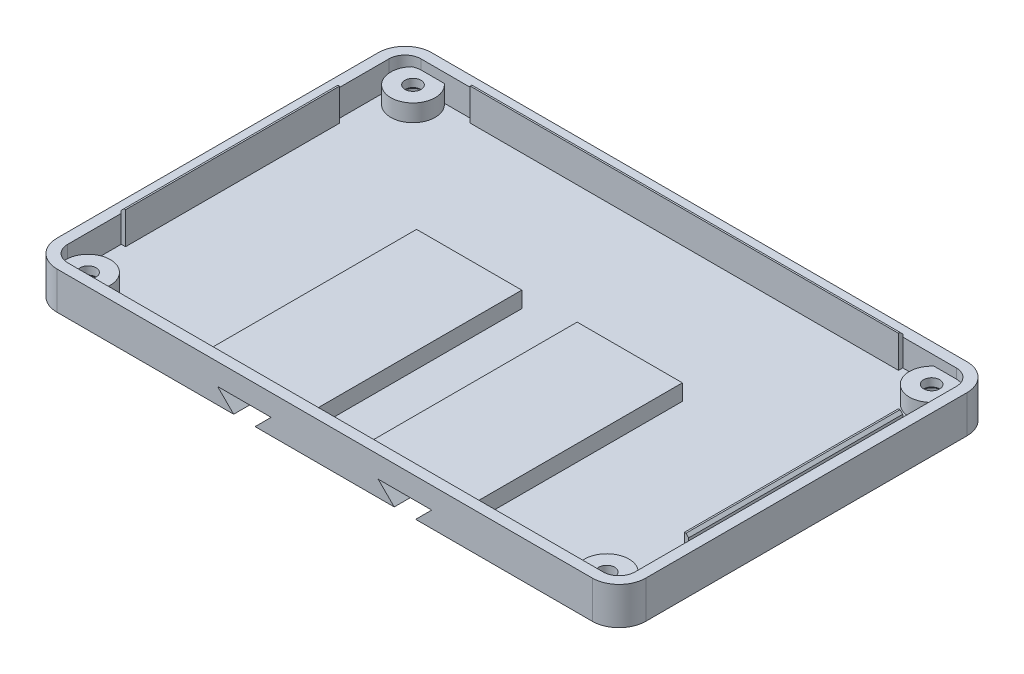
from build123d import *

# Parameters (mm, degrees)
SKETCH1_W               = 110
SKETCH1_H               = 70
BOSS_EXTRUDE1_DEPTH     = 7
FILLET1_R               = 5
CUT_EXTRUDE1_DEPTH      = 40
SHELL1_START            = 5
SHELL1_DEPTH            = 2
SHELL1_START_2          = 2
SHELL1_2_DEPTH          = 3
SHELL1_START_3          = -42
SHELL1_3_DEPTH          = 40
SHELL1_4_DEPTH          = 2
SKETCH2_W               = 80
SKETCH2_H               = 0.8
SKETCH2_W_2             = 0.8
SKETCH2_H_2             = 40
BOSS_EXTRUDE2_DEPTH     = 6
CHAMFER1_SIZE           = 0.5
SKETCH8_R               = 4.15
BOSS_EXTRUDE3_DEPTH     = 3.2
CUT_EXTRUDE5_DEPTH      = 131.48770057
CUT_EXTRUDE5_DEPTH_BACK = 131.48770057
SKETCH9_R               = 1.5
SKETCH10_R              = 3
CUT_EXTRUDE6_DEPTH      = 3.2
CHAMFER2_SIZE           = 0.5
BOSS_EXTRUDE4_REACH     = 120.017


with BuildPart() as part:
    # Sketch1 → Boss-Extrude1 (new body)
    with BuildSketch(Plane(origin=(0, 0, 0), x_dir=(1, 0, 0), z_dir=(0, 1, 0))):
        with Locations((55, 35)):
            Rectangle(SKETCH1_W, SKETCH1_H)
    extrude(amount=BOSS_EXTRUDE1_DEPTH)

    # Fillet1
    fillet1_edges = [part.edges().sort_by_distance(p)[0] for p in [
        (0, 3.5, -70),
        (110, 3.5, -70),
        (110, 3.5, 0),
        (0, 3.5, 0),
    ]]
    fillet(fillet1_edges, radius=FILLET1_R)

    # Sketch3 → Cut-Extrude1 (cut)
    with BuildSketch(Plane.XY):
        Polygon((38, 0), (35, 3), (45, 3), (42, 0), align=None)
        Polygon((68, 0), (65, 3), (75, 3), (72, 0), align=None)
    extrude(amount=-CUT_EXTRUDE1_DEPTH, mode=Mode.SUBTRACT)

    # Shell1: read off the stored shape, not the designer's step
    # Shell1 outline → Shell1 (cut)
    with BuildSketch(Plane(origin=(0, 0, 0), x_dir=(1, 0, 0), z_dir=(0, 1, 0)).offset(SHELL1_START)):
        with BuildLine():
            Line((2, 65), (2, 5))
            ThreePointArc((2, 5), (2.878679656, 2.878679656), (5, 2))
            Line((5, 2), (105, 2))
            ThreePointArc((105, 2), (107.121320344, 2.878679656), (108, 5))
            Line((108, 5), (108, 65))
            ThreePointArc((108, 65), (107.121320344, 67.121320344), (105, 68))
            Line((105, 68), (5, 68))
            ThreePointArc((5, 68), (2.878679656, 67.121320344), (2, 65))
        make_face()
    extrude(amount=SHELL1_DEPTH, mode=Mode.SUBTRACT)

    # Shell1 2 outline → Shell1 2 (cut)
    with BuildSketch(Plane(origin=(0, 0, 0), x_dir=(1, 0, 0), z_dir=(0, 1, 0)).offset(SHELL1_START_2)):
        with BuildLine():
            Line((2, 65), (2, 5))
            ThreePointArc((2, 5), (2.878679656, 2.878679656), (5, 2))
            Line((5, 2), (105, 2))
            ThreePointArc((105, 2), (107.121320344, 2.878679656), (108, 5))
            Line((108, 5), (108, 65))
            ThreePointArc((108, 65), (107.121320344, 67.121320344), (105, 68))
            Line((105, 68), (5, 68))
            ThreePointArc((5, 68), (2.878679656, 67.121320344), (2, 65))
        make_face()
    extrude(amount=SHELL1_2_DEPTH, mode=Mode.SUBTRACT)

    # Shell1 3 outline → Shell1 3 (add)
    with BuildSketch(Plane.XY.offset(SHELL1_START_3)):
        Polygon((36, 2), (35, 3), (45, 3), (44, 2), (46.828427125, 2), (49.828427125, 5), (30.171572875, 5), (33.171572875, 2), align=None)
        Polygon((60.171572875, 5), (63.171572875, 2), (66, 2), (65, 3), (75, 3), (74, 2), (76.828427125, 2), (79.828427125, 5), align=None)
    extrude(amount=SHELL1_3_DEPTH)

    # Shell1 4 outline → Shell1 4 (add)
    with BuildSketch(Plane.XY.offset(SHELL1_START_3)):
        Polygon((45, 3), (35, 3), (36, 2), (44, 2), align=None)
        Polygon((65, 3), (66, 2), (74, 2), (75, 3), align=None)
    extrude(amount=SHELL1_4_DEPTH)

    # Sketch2 → Boss-Extrude2 (add)
    with BuildSketch(Plane(origin=(0, 2, 0), x_dir=(1, 0, 0), z_dir=(0, 1, 0))):
        with Locations((55, 67.6)):
            Rectangle(SKETCH2_W, SKETCH2_H)
        with Locations((107.6, 35)):
            Rectangle(SKETCH2_W_2, SKETCH2_H_2)
        with Locations((2.4, 35)):
            Rectangle(SKETCH2_W_2, SKETCH2_H_2)
    extrude(amount=BOSS_EXTRUDE2_DEPTH)

    # Chamfer1
    chamfer1_edges = [part.edges().sort_by_distance(p)[0] for p in [
        (55, 8, -68),
        (108, 8, -35),
        (2, 8, -35),
    ]]
    chamfer(chamfer1_edges, length=CHAMFER1_SIZE)

    # Sketch8 → Boss-Extrude3 (add)
    with BuildSketch(Plane(origin=(0, 2, 0), x_dir=(1, 0, 0), z_dir=(0, 1, 0))):
        with Locations((103.55, 64.85)):
            Circle(SKETCH8_R)
        with Locations((6.65, 64.85)):
            Circle(SKETCH8_R)
        with Locations((6.65, 4.15)):
            Circle(SKETCH8_R)
        with Locations((103.55, 4.15)):
            Circle(SKETCH8_R)
    extrude(amount=BOSS_EXTRUDE3_DEPTH)

    # Sketch9 → Cut-Extrude5 (cut, two sides: drawn at the far end of the back side and taken through both)
    with BuildSketch(Plane(origin=(0, 5.2, 0), x_dir=(1, 0, 0), z_dir=(0, 1, 0)).offset(-CUT_EXTRUDE5_DEPTH_BACK)):
        with Locations(Location((6.65, 64.85, 0), (0, 0, 270))):
            Circle(SKETCH9_R)
        with Locations(Location((6.65, 4.15, 0), (0, 0, 270))):
            Circle(SKETCH9_R)
        with Locations(Location((103.55, 4.15, 0), (0, 0, 270))):
            Circle(SKETCH9_R)
        with Locations(Location((103.55, 64.85, 0), (0, 0, 270))):
            Circle(SKETCH9_R)
    extrude(amount=CUT_EXTRUDE5_DEPTH + CUT_EXTRUDE5_DEPTH_BACK, mode=Mode.SUBTRACT)

    # Sketch10 → Cut-Extrude6 (cut)
    with BuildSketch(Plane(origin=(0, 0, 0), x_dir=(-1, 0, 0), z_dir=(0, -1, 0))):
        with Locations(Location((-6.65, 4.15, 0), (0, 0, 90))):
            Circle(SKETCH10_R)
        with Locations(Location((-6.65, 64.85, 0), (0, 0, 90))):
            Circle(SKETCH10_R)
        with Locations(Location((-103.55, 64.85, 0), (0, 0, 90))):
            Circle(SKETCH10_R)
        with Locations(Location((-103.55, 4.15, 0), (0, 0, 90))):
            Circle(SKETCH10_R)
    extrude(amount=-CUT_EXTRUDE6_DEPTH, mode=Mode.SUBTRACT)

    # Chamfer2
    chamfer2_edges = [part.edges().sort_by_distance(p)[0] for p in [
        (6.65, 0, -1.15),
        (6.65, 3.2, -5.65),
        (6.65, 0, -61.85),
        (6.65, 3.2, -66.35),
        (103.55, 0, -61.85),
        (103.55, 3.2, -66.35),
        (103.55, 0, -1.15),
        (103.55, 3.2, -5.65),
    ]]
    chamfer(chamfer2_edges, length=CHAMFER2_SIZE)

    # Sketch11 → Boss-Extrude4 (add, up to next)
    with BuildSketch(Plane(origin=(0, 0, -42), x_dir=(-1, 0, 0), z_dir=(0, 0, -1)), mode=Mode.PRIVATE) as boss_extrude4_sk1:
        Polygon((-60.171572875, 5), (-60.171572875, 2), (-63.171572875, 2), align=None)
    boss_extrude4_tool1 = extrude(boss_extrude4_sk1.sketch, amount=-BOSS_EXTRUDE4_REACH, mode=Mode.PRIVATE) - part.part
    # Sketch11 → Boss-Extrude4 (add, up to next)
    with BuildSketch(Plane(origin=(0, 0, -42), x_dir=(-1, 0, 0), z_dir=(0, 0, -1)), mode=Mode.PRIVATE) as boss_extrude4_sk2:
        Polygon((-49.828427125, 5), (-46.828427125, 2), (-49.828427125, 2), align=None)
    boss_extrude4_tool2 = extrude(boss_extrude4_sk2.sketch, amount=-BOSS_EXTRUDE4_REACH, mode=Mode.PRIVATE) - part.part
    # Sketch11 → Boss-Extrude4 (add, up to next)
    with BuildSketch(Plane(origin=(0, 0, -42), x_dir=(-1, 0, 0), z_dir=(0, 0, -1)), mode=Mode.PRIVATE) as boss_extrude4_sk3:
        Polygon((-33.171572875, 2), (-30.171572875, 5), (-30.171572875, 2), align=None)
    boss_extrude4_tool3 = extrude(boss_extrude4_sk3.sketch, amount=-BOSS_EXTRUDE4_REACH, mode=Mode.PRIVATE) - part.part
    # Sketch11 → Boss-Extrude4 (add, up to next)
    with BuildSketch(Plane(origin=(0, 0, -42), x_dir=(-1, 0, 0), z_dir=(0, 0, -1)), mode=Mode.PRIVATE) as boss_extrude4_sk4:
        Polygon((-79.828427125, 5), (-79.828427125, 2), (-76.828427125, 2), align=None)
    boss_extrude4_tool4 = extrude(boss_extrude4_sk4.sketch, amount=-BOSS_EXTRUDE4_REACH, mode=Mode.PRIVATE) - part.part
    add(boss_extrude4_tool1.solids().sort_by_distance((61.171573, 3, -42))[0])
    add(boss_extrude4_tool2.solids().sort_by_distance((48.828427, 3, -42))[0])
    add(boss_extrude4_tool3.solids().sort_by_distance((31.171573, 3, -42))[0])
    add(boss_extrude4_tool4.solids().sort_by_distance((78.828427, 3, -42))[0])


solid = part.part
